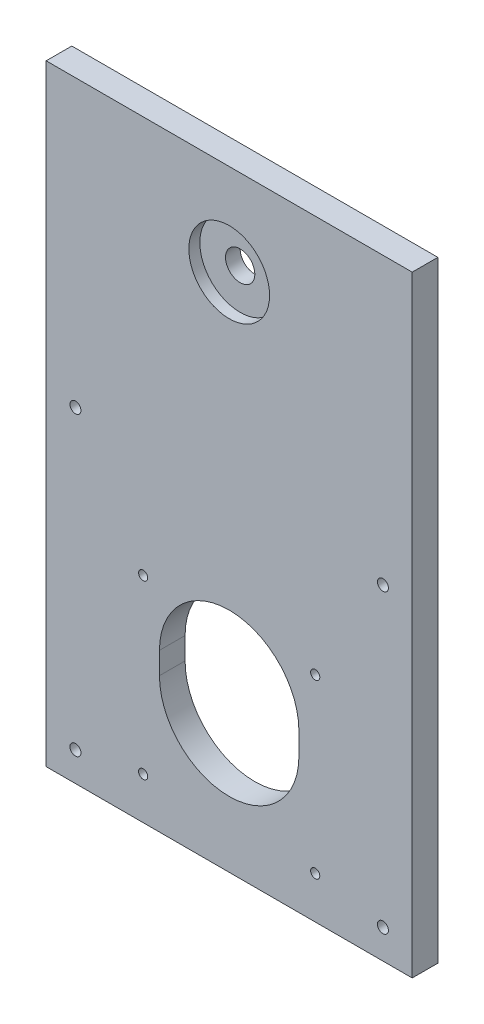
from build123d import *

# Parameters (mm, degrees)
SKETCH1_W           = 100
SKETCH1_H           = 247
SKETCH1_R           = 1.5
SKETCH1_R_2         = 4
SKETCH1_R_3         = 1.25
BOSS_EXTRUDE1_DEPTH = 7
SKETCH2_R           = 11.025
CUT_EXTRUDE1_DEPTH  = 3
CUT_EXTRUDE2_DEPTH  = 3
SKETCH4_W           = 100
SKETCH4_H           = 80
CUT_EXTRUDE3_DEPTH  = 134.421325132


with BuildPart() as part:
    # Sketch1 → Boss-Extrude1 (new body)
    with BuildSketch(Plane.XY):
        Rectangle(SKETCH1_W, SKETCH1_H)
        with Locations((-42, -34.5)):
            Circle(SKETCH1_R, mode=Mode.SUBTRACT)
        with Locations((42, -34.5)):
            Circle(SKETCH1_R, mode=Mode.SUBTRACT)
        with Locations((-42, -115.5)):
            Circle(SKETCH1_R, mode=Mode.SUBTRACT)
        with Locations((42, -115.5)):
            Circle(SKETCH1_R, mode=Mode.SUBTRACT)
        with Locations((0, 18.5)):
            Circle(SKETCH1_R_2, mode=Mode.SUBTRACT)
        with Locations((42, 115.5)):
            Circle(SKETCH1_R, mode=Mode.SUBTRACT)
        with Locations((-42, 115.5)):
            Circle(SKETCH1_R, mode=Mode.SUBTRACT)
        with Locations((-23.5, -65)):
            Circle(SKETCH1_R_3, mode=Mode.SUBTRACT)
        with Locations((-23.5, -112)):
            Circle(SKETCH1_R_3, mode=Mode.SUBTRACT)
        with Locations((23.5, -112)):
            Circle(SKETCH1_R_3, mode=Mode.SUBTRACT)
        with Locations((23.5, -65)):
            Circle(SKETCH1_R_3, mode=Mode.SUBTRACT)
        with BuildLine():
            Line((-19.05, -80.5), (-19.05, -86.5))
            ThreePointArc((-19.05, -86.5), (0, -105.55), (19.05, -86.5))
            Line((19.05, -86.5), (19.05, -80.5))
            ThreePointArc((19.05, -80.5), (0, -61.45), (-19.05, -80.5))
        make_face(mode=Mode.SUBTRACT)
    extrude(amount=BOSS_EXTRUDE1_DEPTH)

    # Sketch2 → Cut-Extrude1 (cut)
    with BuildSketch(Plane.XY.offset(7)):
        with Locations((0, 18.5)):
            Circle(SKETCH2_R)
    extrude(amount=-CUT_EXTRUDE1_DEPTH, mode=Mode.SUBTRACT)

    # Sketch3 → Cut-Extrude2 (cut)
    with BuildSketch(Plane.XY):
        with BuildLine():
            Line((-26.5, -70), (-26.5, -60))
            ThreePointArc((-26.5, -60), (-23.5, -57), (-20.5, -60))
            Line((-20.5, -60), (-20.5, -70))
            ThreePointArc((-20.5, -70), (-23.5, -73), (-26.5, -70))
        make_face()
        with BuildLine():
            Line((20.5, -70), (20.5, -60))
            ThreePointArc((20.5, -60), (23.5, -57), (26.5, -60))
            Line((26.5, -60), (26.5, -70))
            ThreePointArc((26.5, -70), (23.5, -73), (20.5, -70))
        make_face()
        with BuildLine():
            Line((-26.5, -117), (-26.5, -107))
            ThreePointArc((-26.5, -107), (-23.5, -104), (-20.5, -107))
            Line((-20.5, -107), (-20.5, -117))
            ThreePointArc((-20.5, -117), (-23.5, -120), (-26.5, -117))
        make_face()
        with BuildLine():
            Line((20.5, -117), (20.5, -107))
            ThreePointArc((20.5, -107), (23.5, -104), (26.5, -107))
            Line((26.5, -107), (26.5, -117))
            ThreePointArc((26.5, -117), (23.5, -120), (20.5, -117))
        make_face()
    extrude(amount=CUT_EXTRUDE2_DEPTH, mode=Mode.SUBTRACT)

    # Sketch4 → Cut-Extrude3 (cut, through all)
    with BuildSketch(Plane.XY.offset(7)):
        with Locations((0, 83.5)):
            Rectangle(SKETCH4_W, SKETCH4_H)
    extrude(amount=-CUT_EXTRUDE3_DEPTH, mode=Mode.SUBTRACT)


solid = part.part
